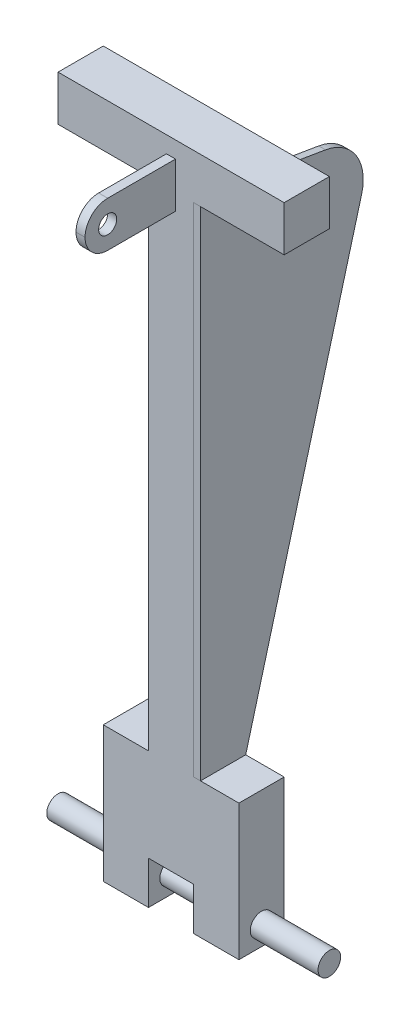
from build123d import *

# Parameters (mm, degrees)
BOSS_EXTRUDE1_DEPTH      = 10
SKETCH5_W                = 2
SKETCH5_H                = 10
BOSS_EXTRUDE2_DEPTH      = 20
FILLET1_R                = 5
SKETCH6_R                = 2
CUT_EXTRUDE2_DEPTH       = 20
BOSS_EXTRUDE3_DEPTH      = 1.5
BOSS_EXTRUDE4_DEPTH      = 15
BOSS_EXTRUDE4_DEPTH_BACK = 45
SKETCH2_R                = 2.5


with BuildPart() as part:
    # Sketch1 → Boss-Extrude1 (new body)
    with BuildSketch(Plane.XY):
        Polygon((-5, 70), (5, 70), (25, 70), (25, 80), (-25, 80), (-25, 70), align=None)
        Polygon((5, -60.555274141), (5, -40), (5, 70), (-5, 70), (-5, -40), (-5, -60.555274141), align=None)
        Polygon((-5, -70), (-5, -60.555274141), (-5, -40), (-15, -40), (-15, -70), align=None)
        Polygon((5, -70), (15, -70), (15, -40), (5, -40), (5, -60.555274141), align=None)
    extrude(amount=BOSS_EXTRUDE1_DEPTH)

    # Sketch5 → Boss-Extrude2 (add)
    with BuildSketch(Plane.XY.offset(10)):
        with Locations((-0.025385346, 71.338218607)):
            Rectangle(SKETCH5_W, SKETCH5_H)
    extrude(amount=BOSS_EXTRUDE2_DEPTH)

    # Fillet1
    fillet1_edges = [part.edges().sort_by_distance(p)[0] for p in [
        (-0.025385346, 66.338218607, 30),
        (-0.025385346, 76.338218607, 30),
    ]]
    fillet(fillet1_edges, radius=FILLET1_R - 0.0001)  # a hair under: the kernel refuses the full size

    # Sketch6 → Cut-Extrude2 (cut)
    with BuildSketch(Plane(origin=(0.974614654, 0, 0), x_dir=(0, 0, -1), z_dir=(1, 0, 0))):
        with Locations((-25, 71.338218607)):
            Circle(SKETCH6_R)
    extrude(amount=-CUT_EXTRUDE2_DEPTH, mode=Mode.SUBTRACT)

    # Sketch2 → Boss-Extrude4 (add, two sides: drawn at the far end of the back side and taken through both)
    with BuildSketch(Plane(origin=(15, 0, 0), x_dir=(0, 0, -1), z_dir=(1, 0, 0)).offset(-BOSS_EXTRUDE4_DEPTH_BACK)):
        with Locations((-5, -65.709613715)):
            Circle(SKETCH2_R)
    extrude(amount=BOSS_EXTRUDE4_DEPTH + BOSS_EXTRUDE4_DEPTH_BACK)


with BuildPart() as body_2:
    # Sketch7 → Boss-Extrude3 (new body)
    with BuildSketch(Plane(origin=(5, 0, 0), x_dir=(0, 0, -1), z_dir=(1, 0, 0))):
        with BuildLine():
            Line((0, 70), (17.646012218, 67.040408019))
            ThreePointArc((17.646012218, 67.040408019), (24.41144088, 62.573672726), (25.643325146, 54.560857346))
            Line((25.643325146, 54.560857346), (0, -40))
            Line((0, -40), (-10, -40))
            Line((-10, -40), (-10, 70))
            Line((-10, 70), (0, 70))
        make_face()
    extrude(amount=BOSS_EXTRUDE3_DEPTH)


solid = Compound([part.part, body_2.part])
